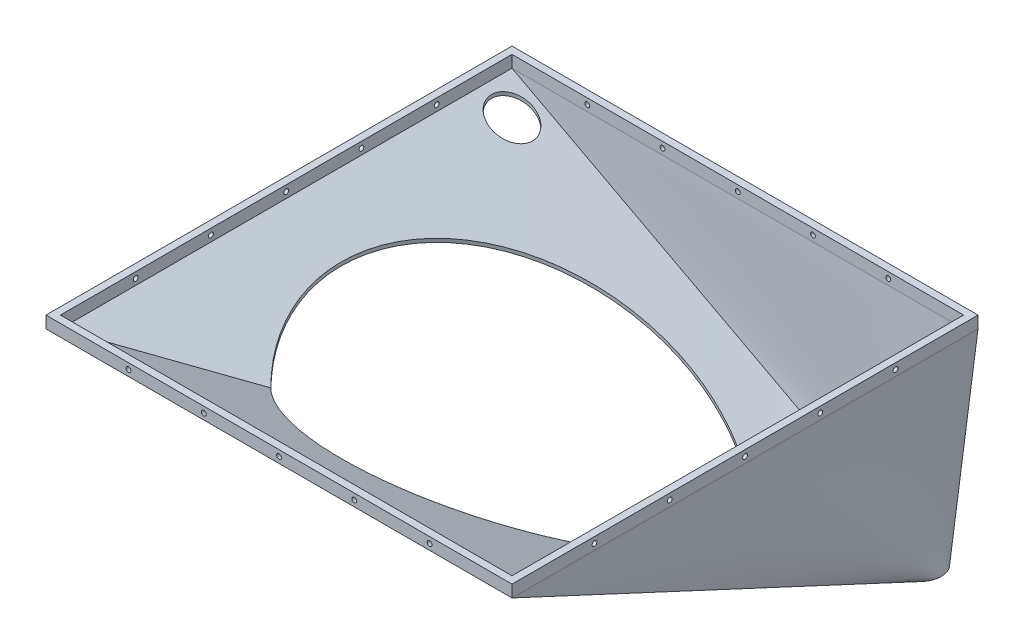
from build123d import *

# Parameters (mm, degrees)
SKETCH5_R           = 71
SKETCH5_R_2         = 8.5
CUT_EXTRUDE1_DEPTH  = 151
SKETCH6_W           = 194
SKETCH6_H           = 194
SKETCH6_W_2         = 188
SKETCH6_H_2         = 188
BOSS_EXTRUDE1_DEPTH = 5
SKETCH10_R          = 1
CUT_EXTRUDE2_DEPTH  = 3
SKETCH9_R           = 1
CUT_EXTRUDE3_DEPTH  = 3
SKETCH11_R          = 1
CUT_EXTRUDE4_DEPTH  = 3
SKETCH12_R          = 1
CUT_EXTRUDE5_DEPTH  = 3


with BuildPart() as part:
    # Loft1: read off the stored shape, not the designer's step
    # Loft1: loft between two sections, ruled curve by curve
    loft1_from = [
        Edge.make_bspline([(97, 0, -97), (97, 0, -88.916666667), (97, 0, -80.833333333), (97, 0, -64.666666667), (97, 0, -56.583333333), (97, 0, -40.416666667), (97, 0, -32.333333333), (97, 0, -16.166666667), (97, 0, -8.083333333), (97, 0, 8.083333333), (97, 0, 16.166666667), (97, 0, 32.333333333), (97, 0, 40.416666667), (97, 0, 56.583333333), (97, 0, 64.666666667), (97, 0, 80.833333333), (97, 0, 88.916666667), (97, 0, 97)], [0, 0, 0, 0, 0.125, 0.125, 0.25, 0.25, 0.375, 0.375, 0.5, 0.5, 0.625, 0.625, 0.75, 0.75, 0.875, 0.875, 1, 1, 1, 1], 3),
        Edge.make_bspline([(97, 0, 97), (88.916666667, 0, 97), (80.833333333, 0, 97), (64.666666667, 0, 97), (56.583333333, 0, 97), (40.416666667, 0, 97), (32.333333333, 0, 97), (16.166666667, 0, 97), (8.083333333, 0, 97), (-8.083333333, 0, 97), (-16.166666667, 0, 97), (-32.333333333, 0, 97), (-40.416666667, 0, 97), (-56.583333333, 0, 97), (-64.666666667, 0, 97), (-80.833333333, 0, 97), (-88.916666667, 0, 97), (-97, 0, 97)], [0, 0, 0, 0, 0.125, 0.125, 0.25, 0.25, 0.375, 0.375, 0.5, 0.5, 0.625, 0.625, 0.75, 0.75, 0.875, 0.875, 1, 1, 1, 1], 3),
        Edge.make_bspline([(-97, 0, -97), (-88.916666667, 0, -97), (-80.833333333, 0, -97), (-64.666666667, 0, -97), (-56.583333333, 0, -97), (-40.416666667, 0, -97), (-32.333333333, 0, -97), (-16.166666667, 0, -97), (-8.083333333, 0, -97), (8.083333333, 0, -97), (16.166666667, 0, -97), (32.333333333, 0, -97), (40.416666667, 0, -97), (56.583333333, 0, -97), (64.666666667, 0, -97), (80.833333333, 0, -97), (88.916666667, 0, -97), (97, 0, -97)], [0, 0, 0, 0, 0.125, 0.125, 0.25, 0.25, 0.375, 0.375, 0.5, 0.5, 0.625, 0.625, 0.75, 0.75, 0.875, 0.875, 1, 1, 1, 1], 3),
        Edge.make_bspline([(-97, 0, 97), (-97, 0, 88.916666667), (-97, 0, 80.833333333), (-97, 0, 64.666666667), (-97, 0, 56.583333333), (-97, 0, 40.416666667), (-97, 0, 32.333333333), (-97, 0, 16.166666667), (-97, 0, 8.083333333), (-97, 0, -8.083333333), (-97, 0, -16.166666667), (-97, 0, -32.333333333), (-97, 0, -40.416666667), (-97, 0, -56.583333333), (-97, 0, -64.666666667), (-97, 0, -80.833333333), (-97, 0, -88.916666667), (-97, 0, -97)], [0, 0, 0, 0, 0.125, 0.125, 0.25, 0.25, 0.375, 0.375, 0.5, 0.5, 0.625, 0.625, 0.75, 0.75, 0.875, 0.875, 1, 1, 1, 1], 3),
    ]
    loft1_to = [
        Edge.make_bspline([(91.098795988, -85, -91.098795988), (91.458170988, -85, -90.739420988), (91.799037731, -85, -90.334659022), (92.414431009, -85, -89.439787581), (92.688758295, -85, -88.949632407), (93.1422891, -85, -87.901676838), (93.321270322, -85, -87.343958489), (93.562700706, -85, -86.190729946), (93.625, -85, -85.595431996), (93.625, -85, -84.404568004), (93.562700706, -85, -83.809270054), (93.321270322, -85, -82.656041511), (93.1422891, -85, -82.098323162), (92.688758295, -85, -81.050367593), (92.414431009, -85, -80.560212419), (91.799037731, -85, -79.665340978), (91.458170988, -85, -79.260579012), (91.098795988, -85, -78.901204012)], [0, 0, 0, 0, 0.125, 0.125, 0.25, 0.25, 0.375, 0.375, 0.5, 0.5, 0.625, 0.625, 0.75, 0.75, 0.875, 0.875, 1, 1, 1, 1], 3),
        Edge.make_bspline([(91.098795988, -85, -78.901204012), (90.739420988, -85, -78.541829012), (90.334659022, -85, -78.200962269), (89.439787581, -85, -77.585568991), (88.949632407, -85, -77.311241705), (87.901676838, -85, -76.8577109), (87.343958489, -85, -76.678729678), (86.190729946, -85, -76.437299294), (85.595431996, -85, -76.375), (84.404568004, -85, -76.375), (83.809270054, -85, -76.437299294), (82.656041511, -85, -76.678729678), (82.098323162, -85, -76.8577109), (81.050367593, -85, -77.311241705), (80.560212419, -85, -77.585568991), (79.665340978, -85, -78.200962269), (79.260579012, -85, -78.541829012), (78.901204012, -85, -78.901204012)], [0, 0, 0, 0, 0.125, 0.125, 0.25, 0.25, 0.375, 0.375, 0.5, 0.5, 0.625, 0.625, 0.75, 0.75, 0.875, 0.875, 1, 1, 1, 1], 3),
        Edge.make_bspline([(78.901204012, -85, -91.098795988), (79.260579012, -85, -91.458170988), (79.665340978, -85, -91.799037731), (80.560212419, -85, -92.414431009), (81.050367593, -85, -92.688758295), (82.098323162, -85, -93.1422891), (82.656041511, -85, -93.321270322), (83.809270054, -85, -93.562700706), (84.404568004, -85, -93.625), (85.595431996, -85, -93.625), (86.190729946, -85, -93.562700706), (87.343958489, -85, -93.321270322), (87.901676838, -85, -93.1422891), (88.949632407, -85, -92.688758295), (89.439787581, -85, -92.414431009), (90.334659022, -85, -91.799037731), (90.739420988, -85, -91.458170988), (91.098795988, -85, -91.098795988)], [0, 0, 0, 0, 0.125, 0.125, 0.25, 0.25, 0.375, 0.375, 0.5, 0.5, 0.625, 0.625, 0.75, 0.75, 0.875, 0.875, 1, 1, 1, 1], 3),
        Edge.make_bspline([(78.901204012, -85, -78.901204012), (78.541829012, -85, -79.260579012), (78.200962269, -85, -79.665340978), (77.585568991, -85, -80.560212419), (77.311241705, -85, -81.050367593), (76.8577109, -85, -82.098323162), (76.678729678, -85, -82.656041511), (76.437299294, -85, -83.809270054), (76.375, -85, -84.404568004), (76.375, -85, -85.595431996), (76.437299294, -85, -86.190729946), (76.678729678, -85, -87.343958489), (76.8577109, -85, -87.901676838), (77.311241705, -85, -88.949632407), (77.585568991, -85, -89.439787581), (78.200962269, -85, -90.334659022), (78.541829012, -85, -90.739420988), (78.901204012, -85, -91.098795988)], [0, 0, 0, 0, 0.125, 0.125, 0.25, 0.25, 0.375, 0.375, 0.5, 0.5, 0.625, 0.625, 0.75, 0.75, 0.875, 0.875, 1, 1, 1, 1], 3),
    ]
    loft1 = Solid(Shell([*[Face.make_surface_from_curves(loft1_from[k], loft1_to[k]) for k in range(4)], Face(Wire(loft1_from)), Face(Wire(loft1_to))]))
    add(loft1)

    # Cut-Loft1: read off the stored shape, not the designer's step
    # Cut-Loft1: loft between two sections, ruled curve by curve
    cut_loft1_from = [
        Edge.make_bspline([(-94, 0, 94), (-94, 0, 86.166666667), (-94, 0, 78.333333333), (-94, 0, 62.666666667), (-94, 0, 54.833333333), (-94, 0, 39.166666667), (-94, 0, 31.333333333), (-94, 0, 15.666666667), (-94, 0, 7.833333333), (-94, 0, -7.833333333), (-94, 0, -15.666666667), (-94, 0, -31.333333333), (-94, 0, -39.166666667), (-94, 0, -54.833333333), (-94, 0, -62.666666667), (-94, 0, -78.333333333), (-94, 0, -86.166666667), (-94, 0, -94)], [0, 0, 0, 0, 0.125, 0.125, 0.25, 0.25, 0.375, 0.375, 0.5, 0.5, 0.625, 0.625, 0.75, 0.75, 0.875, 0.875, 1, 1, 1, 1], 3),
        Edge.make_bspline([(-94, 0, -94), (-86.166666667, 0, -94), (-78.333333333, 0, -94), (-62.666666667, 0, -94), (-54.833333333, 0, -94), (-39.166666667, 0, -94), (-31.333333333, 0, -94), (-15.666666667, 0, -94), (-7.833333333, 0, -94), (7.833333333, 0, -94), (15.666666667, 0, -94), (31.333333333, 0, -94), (39.166666667, 0, -94), (54.833333333, 0, -94), (62.666666667, 0, -94), (78.333333333, 0, -94), (86.166666667, 0, -94), (94, 0, -94)], [0, 0, 0, 0, 0.125, 0.125, 0.25, 0.25, 0.375, 0.375, 0.5, 0.5, 0.625, 0.625, 0.75, 0.75, 0.875, 0.875, 1, 1, 1, 1], 3),
        Edge.make_bspline([(94, 0, 94), (86.166666667, 0, 94), (78.333333333, 0, 94), (62.666666667, 0, 94), (54.833333333, 0, 94), (39.166666667, 0, 94), (31.333333333, 0, 94), (15.666666667, 0, 94), (7.833333333, 0, 94), (-7.833333333, 0, 94), (-15.666666667, 0, 94), (-31.333333333, 0, 94), (-39.166666667, 0, 94), (-54.833333333, 0, 94), (-62.666666667, 0, 94), (-78.333333333, 0, 94), (-86.166666667, 0, 94), (-94, 0, 94)], [0, 0, 0, 0, 0.125, 0.125, 0.25, 0.25, 0.375, 0.375, 0.5, 0.5, 0.625, 0.625, 0.75, 0.75, 0.875, 0.875, 1, 1, 1, 1], 3),
        Edge.make_bspline([(94, 0, -94), (94, 0, -86.166666667), (94, 0, -78.333333333), (94, 0, -62.666666667), (94, 0, -54.833333333), (94, 0, -39.166666667), (94, 0, -31.333333333), (94, 0, -15.666666667), (94, 0, -7.833333333), (94, 0, 7.833333333), (94, 0, 15.666666667), (94, 0, 31.333333333), (94, 0, 39.166666667), (94, 0, 54.833333333), (94, 0, 62.666666667), (94, 0, 78.333333333), (94, 0, 86.166666667), (94, 0, 94)], [0, 0, 0, 0, 0.125, 0.125, 0.25, 0.25, 0.375, 0.375, 0.5, 0.5, 0.625, 0.625, 0.75, 0.75, 0.875, 0.875, 1, 1, 1, 1], 3),
    ]
    cut_loft1_to = [
        Edge.make_bspline([(81.022524356, -85, -81.022524356), (80.788149356, -85, -81.256899356), (80.565844958, -85, -81.520874551), (80.164501516, -85, -82.10448636), (79.985592416, -85, -82.424152778), (79.689811456, -85, -83.107602062), (79.573084572, -85, -83.47133142), (79.415629975, -85, -84.223436992), (79.375, -85, -84.611674785), (79.375, -85, -85.388325215), (79.415629975, -85, -85.776563008), (79.573084572, -85, -86.52866858), (79.689811456, -85, -86.892397938), (79.985592416, -85, -87.575847222), (80.164501516, -85, -87.89551364), (80.565844958, -85, -88.479125449), (80.788149356, -85, -88.743100644), (81.022524356, -85, -88.977475644)], [0, 0, 0, 0, 0.125, 0.125, 0.25, 0.25, 0.375, 0.375, 0.5, 0.5, 0.625, 0.625, 0.75, 0.75, 0.875, 0.875, 1, 1, 1, 1], 3),
        Edge.make_bspline([(81.022524356, -85, -88.977475644), (81.256899356, -85, -89.211850644), (81.520874551, -85, -89.434155042), (82.10448636, -85, -89.835498484), (82.424152778, -85, -90.014407584), (83.107602062, -85, -90.310188544), (83.47133142, -85, -90.426915428), (84.223436992, -85, -90.584370025), (84.611674785, -85, -90.625), (85.388325215, -85, -90.625), (85.776563008, -85, -90.584370025), (86.52866858, -85, -90.426915428), (86.892397938, -85, -90.310188544), (87.575847222, -85, -90.014407584), (87.89551364, -85, -89.835498484), (88.479125449, -85, -89.434155042), (88.743100644, -85, -89.211850644), (88.977475644, -85, -88.977475644)], [0, 0, 0, 0, 0.125, 0.125, 0.25, 0.25, 0.375, 0.375, 0.5, 0.5, 0.625, 0.625, 0.75, 0.75, 0.875, 0.875, 1, 1, 1, 1], 3),
        Edge.make_bspline([(88.977475644, -85, -81.022524356), (88.743100644, -85, -80.788149356), (88.479125449, -85, -80.565844958), (87.89551364, -85, -80.164501516), (87.575847222, -85, -79.985592416), (86.892397938, -85, -79.689811456), (86.52866858, -85, -79.573084572), (85.776563008, -85, -79.415629975), (85.388325215, -85, -79.375), (84.611674785, -85, -79.375), (84.223436992, -85, -79.415629975), (83.47133142, -85, -79.573084572), (83.107602062, -85, -79.689811456), (82.424152778, -85, -79.985592416), (82.10448636, -85, -80.164501516), (81.520874551, -85, -80.565844958), (81.256899356, -85, -80.788149356), (81.022524356, -85, -81.022524356)], [0, 0, 0, 0, 0.125, 0.125, 0.25, 0.25, 0.375, 0.375, 0.5, 0.5, 0.625, 0.625, 0.75, 0.75, 0.875, 0.875, 1, 1, 1, 1], 3),
        Edge.make_bspline([(88.977475644, -85, -88.977475644), (89.211850644, -85, -88.743100644), (89.434155042, -85, -88.479125449), (89.835498484, -85, -87.89551364), (90.014407584, -85, -87.575847222), (90.310188544, -85, -86.892397938), (90.426915428, -85, -86.52866858), (90.584370025, -85, -85.776563008), (90.625, -85, -85.388325215), (90.625, -85, -84.611674785), (90.584370025, -85, -84.223436992), (90.426915428, -85, -83.47133142), (90.310188544, -85, -83.107602062), (90.014407584, -85, -82.424152778), (89.835498484, -85, -82.10448636), (89.434155042, -85, -81.520874551), (89.211850644, -85, -81.256899356), (88.977475644, -85, -81.022524356)], [0, 0, 0, 0, 0.125, 0.125, 0.25, 0.25, 0.375, 0.375, 0.5, 0.5, 0.625, 0.625, 0.75, 0.75, 0.875, 0.875, 1, 1, 1, 1], 3),
    ]
    cut_loft1 = Solid(Shell([*[Face.make_surface_from_curves(cut_loft1_from[k], cut_loft1_to[k]) for k in range(4)], Face(Wire(cut_loft1_from)), Face(Wire(cut_loft1_to))]))
    add(cut_loft1, mode=Mode.SUBTRACT)

    # Sketch5 → Cut-Extrude1 (cut)
    with BuildSketch(Plane(origin=(0, 0, 0), x_dir=(1, 0, 0), z_dir=(0, 1, 0))):
        with Locations(Location((0, 0, 0), (0, 0, 225))):
            Circle(SKETCH5_R)
        with Locations(Location((-82, 82, 0), (0, 0, 270))):
            Circle(SKETCH5_R_2)
    extrude(amount=-CUT_EXTRUDE1_DEPTH, mode=Mode.SUBTRACT)

    # Sketch6 → Boss-Extrude1 (add)
    with BuildSketch(Plane(origin=(0, 0, 0), x_dir=(1, 0, 0), z_dir=(0, 1, 0))):
        Rectangle(SKETCH6_W, SKETCH6_H)
        Rectangle(SKETCH6_W_2, SKETCH6_H_2, mode=Mode.SUBTRACT)
    extrude(amount=BOSS_EXTRUDE1_DEPTH)

    # Sketch10 → Cut-Extrude2 (cut)
    with BuildSketch(Plane.XY.offset(-94)):
        with Locations((-62.67, 2.5)):
            Circle(SKETCH10_R)
        with Locations((-31.34, 2.5)):
            Circle(SKETCH10_R)
        with Locations((-0.01, 2.5)):
            Circle(SKETCH10_R)
        with Locations((31.32, 2.5)):
            Circle(SKETCH10_R)
        with Locations((62.65, 2.5)):
            Circle(SKETCH10_R)
    extrude(amount=-CUT_EXTRUDE2_DEPTH, mode=Mode.SUBTRACT)

    # Sketch9 → Cut-Extrude3 (cut)
    with BuildSketch(Plane(origin=(-94, 0, 0), x_dir=(0, 0, -1), z_dir=(1, 0, 0))):
        with Locations((-62.67, 2.5)):
            Circle(SKETCH9_R)
        with Locations((-31.34, 2.5)):
            Circle(SKETCH9_R)
        with Locations((-0.01, 2.5)):
            Circle(SKETCH9_R)
        with Locations((31.32, 2.5)):
            Circle(SKETCH9_R)
        with Locations((62.65, 2.5)):
            Circle(SKETCH9_R)
    extrude(amount=-CUT_EXTRUDE3_DEPTH, mode=Mode.SUBTRACT)

    # Sketch11 → Cut-Extrude4 (cut)
    with BuildSketch(Plane(origin=(0, 0, 94), x_dir=(-1, 0, 0), z_dir=(0, 0, -1))):
        with Locations((-62.67, 2.5)):
            Circle(SKETCH11_R)
        with Locations((-31.34, 2.5)):
            Circle(SKETCH11_R)
        with Locations((-0.01, 2.5)):
            Circle(SKETCH11_R)
        with Locations((31.32, 2.5)):
            Circle(SKETCH11_R)
        with Locations((62.65, 2.5)):
            Circle(SKETCH11_R)
    extrude(amount=-CUT_EXTRUDE4_DEPTH, mode=Mode.SUBTRACT)

    # Sketch12 → Cut-Extrude5 (cut)
    with BuildSketch(Plane.ZY.offset(-94)):
        with Locations((-62.67, 2.5)):
            Circle(SKETCH12_R)
        with Locations((-31.34, 2.5)):
            Circle(SKETCH12_R)
        with Locations((-0.01, 2.5)):
            Circle(SKETCH12_R)
        with Locations((31.32, 2.5)):
            Circle(SKETCH12_R)
        with Locations((62.65, 2.5)):
            Circle(SKETCH12_R)
    extrude(amount=-CUT_EXTRUDE5_DEPTH, mode=Mode.SUBTRACT)


solid = part.part
